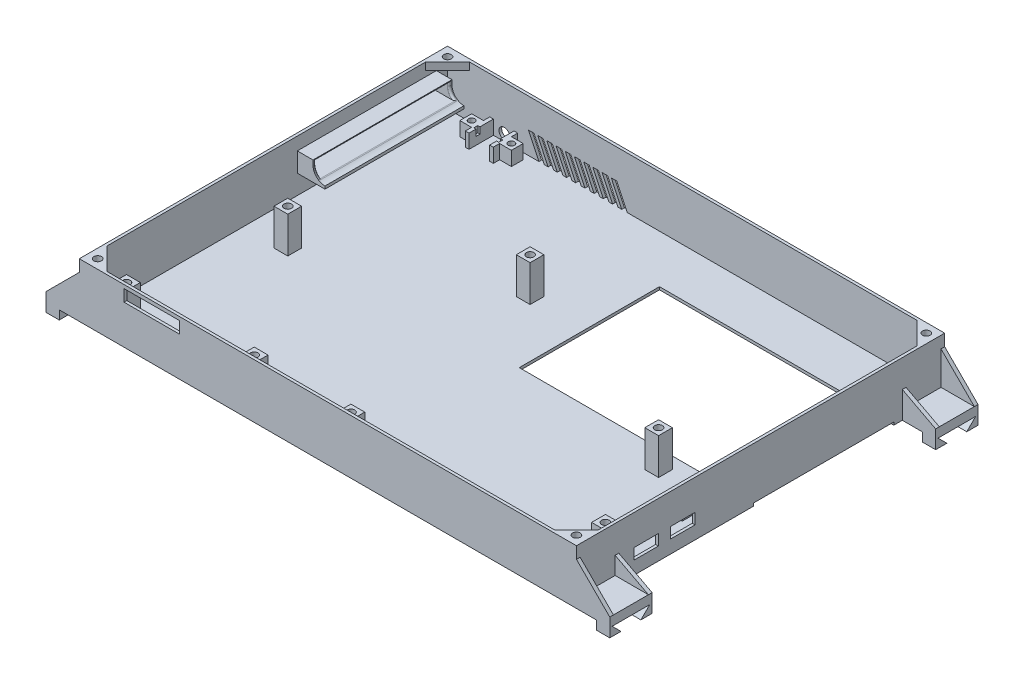
from build123d import *

# Parameters (mm, degrees)
SKETCH_1_W            = 270
SKETCH_1_H            = 200
EXTRUDE_1_DEPTH       = 1.5
EXTRUDE_2_DEPTH       = 28
SKETCH_3_W            = 30.2
SKETCH_3_H            = 1.5
EXTRUDE_3_DEPTH       = 19.7
SKETCH_4_W            = 1.5
SKETCH_4_H            = 1.9
EXTRUDE_4_DEPTH       = 30.2
SKETCH_5_W            = 13.3
SKETCH_5_H            = 5.9
CUT_EXTRUDE_1_DEPTH   = 1.5
SKETCH_10_W           = 7.5
SKETCH_10_H           = 7.5
EXTRUDE_6_DEPTH       = 6.9
SKETCH_11_W           = 7.5
SKETCH_11_H           = 7.5
EXTRUDE_7_DEPTH       = 19.7
SKETCH_12_W           = 127.3
SKETCH_12_H           = 76.15
CUT_EXTRUDE_2_DEPTH   = 171.320286519
SKETCH_14_R           = 2.05
CUT_EXTRUDE_4_DEPTH   = 5
SKETCH_15_R           = 2.05
CUT_EXTRUDE_5_DEPTH   = 5
EXTRUDE_START         = -7.58237
EXTRUDE_8_DEPTH       = 75.5
CUT_EXTRUDE_START     = -74
CUT_EXTRUDE_6_DEPTH   = 72.5
FILLET_1_R            = 1
SKETCH_19_W           = 15
SKETCH_19_H           = 1.5
EXTRUDE_9_DEPTH       = 75.5
CUT_EXTRUDE_7_DEPTH   = 1.5
SKETCH_21_R           = 2.9
CUT_EXTRUDE_8_DEPTH   = 1.5
SKETCH_22_W           = 2
SKETCH_22_H           = 13.25
EXTRUDE_10_DEPTH      = 7.65
SKETCH_23_W           = 1.2
SKETCH_23_H           = 2.2
CUT_EXTRUDE_9_DEPTH   = 3.45
SKETCH_24_W           = 6.4
SKETCH_24_H           = 6.4
EXTRUDE_11_DEPTH      = 7.65
SKETCH_25_R           = 1.7
CUT_EXTRUDE_10_DEPTH  = 3
EXTRUDE_12_DEPTH      = 4
SKETCH_27_R           = 2.05
CUT_EXTRUDE_11_DEPTH  = 4
SKETCH_29_W           = 23
SKETCH_29_H           = 5
EXTRUDE_13_DEPTH      = 18.1
EXTRUDE_14_DEPTH      = 7.2
EXTRUDE_15_DEPTH      = 2
EXTRUDE_16_DEPTH      = 2
MIRROR_7_COPY_1_DEPTH = 2
MIRROR_7_COPY_2_DEPTH = 2


with BuildPart() as part:
    # Эскиз1 → Бобышка-Вытянуть1 (new body)
    with BuildSketch(Plane(origin=(0, 0, 0), x_dir=(1, 0, 0), z_dir=(0, 1, 0))):
        Rectangle(SKETCH_1_W, SKETCH_1_H)
    extrude(amount=EXTRUDE_1_DEPTH)

    # Эскиз2 → Бобышка-Вытянуть2 (add)
    with BuildSketch(Plane(origin=(0, 1.5, 0), x_dir=(1, 0, 0), z_dir=(0, 1, 0))):
        Polygon((133.5, 98.5), (-133.5, 98.5), (-133.5, -98.5), (-110.7, -98.5), (-110.7, -100), (-135, -100), (-135, 100), (135, 100), (135, -100), (-80.5, -100), (-80.5, -98.5), (133.5, -98.5), align=None)
    extrude(amount=EXTRUDE_2_DEPTH)

    # Эскиз3 → Бобышка-Вытянуть3 (add)
    with BuildSketch(Plane(origin=(0, 1.5, 0), x_dir=(1, 0, 0), z_dir=(0, 1, 0))):
        with Locations((-95.6, -99.25)):
            Rectangle(SKETCH_3_W, SKETCH_3_H)
    extrude(amount=EXTRUDE_3_DEPTH)

    # Эскиз4 → Бобышка-Вытянуть4 (add)
    with BuildSketch(Plane(origin=(-110.7, 0, 0), x_dir=(0, 0, -1), z_dir=(1, 0, 0))):
        with Locations((-99.25, 28.55)):
            Rectangle(SKETCH_4_W, SKETCH_4_H)
    extrude(amount=EXTRUDE_4_DEPTH)

    # Эскиз5 → Вырез-Вытянуть1 (cut)
    with BuildSketch(Plane(origin=(135, 0, 0), x_dir=(0, 0, -1), z_dir=(1, 0, 0))):
        with Locations((-62.2, 10.05)):
            Rectangle(SKETCH_5_W, SKETCH_5_H)
        with Locations((-42.2, 10.05)):
            Rectangle(SKETCH_5_W, SKETCH_5_H)
    extrude(amount=-CUT_EXTRUDE_1_DEPTH, mode=Mode.SUBTRACT)

    # Эскиз10 → Бобышка-Вытянуть6 (add)
    with BuildSketch(Plane(origin=(0, 1.5, 0), x_dir=(1, 0, 0), z_dir=(0, 1, 0))):
        with Locations((120.425, -27.975)):
            Rectangle(SKETCH_10_W, SKETCH_10_H)
        with Locations((110.8, -60.05)):
            Rectangle(SKETCH_10_W, SKETCH_10_H)
        with Locations((111.425, -93.025)):
            Rectangle(SKETCH_10_W, SKETCH_10_H)
    extrude(amount=EXTRUDE_6_DEPTH)

    # Эскиз11 → Бобышка-Вытянуть7 (add)
    with BuildSketch(Plane(origin=(0, 1.5, 0), x_dir=(1, 0, 0), z_dir=(0, 1, 0))):
        with Locations((-50.49457, -89.5)):
            Rectangle(SKETCH_11_W, SKETCH_11_H)
        with Locations((-22.77243, 32.59906)):
            Rectangle(SKETCH_11_W, SKETCH_11_H)
        with Locations((-119.29457, -90.09238)):
            Rectangle(SKETCH_11_W, SKETCH_11_H)
        with Locations((-111.4, -10.38237)):
            Rectangle(SKETCH_11_W, SKETCH_11_H)
        with Locations((93.47787, -13.86955)):
            Rectangle(SKETCH_11_W, SKETCH_11_H)
        with Locations((90.30543, -95.26955)):
            Rectangle(SKETCH_11_W, SKETCH_11_H)
        with Locations((2.60543, -90.07853)):
            Rectangle(SKETCH_11_W, SKETCH_11_H)
    extrude(amount=EXTRUDE_7_DEPTH)

    # Эскиз12 → Вырез-Вытянуть2 (cut, through all)
    with BuildSketch(Plane(origin=(0, 1.5, 0), x_dir=(1, 0, 0), z_dir=(0, 1, 0))):
        with Locations((71.35, 34.325)):
            Rectangle(SKETCH_12_W, SKETCH_12_H)
    extrude(amount=-CUT_EXTRUDE_2_DEPTH, mode=Mode.SUBTRACT)

    # Эскиз14 → Вырез-Вытянуть4 (cut)
    with BuildSketch(Plane(origin=(0, 21.2, 0), x_dir=(1, 0, 0), z_dir=(0, 1, 0))):
        with Locations(Location((-22.77243, 32.59906, 0), (0, 0, 270))):
            Circle(SKETCH_14_R)
        with Locations(Location((-111.4, -10.38237, 0), (0, 0, 270))):
            Circle(SKETCH_14_R)
        with Locations(Location((-119.29457, -90.09238, 0), (0, 0, 270))):
            Circle(SKETCH_14_R)
        with Locations(Location((-50.49457, -89.5, 0), (0, 0, 270))):
            Circle(SKETCH_14_R)
        with Locations(Location((2.60543, -90.07853, 0), (0, 0, 270))):
            Circle(SKETCH_14_R)
        with Locations(Location((90.30543, -95.26955, 0), (0, 0, 270))):
            Circle(SKETCH_14_R)
        with Locations(Location((93.47787, -13.86955, 0), (0, 0, 270))):
            Circle(SKETCH_14_R)
    extrude(amount=-CUT_EXTRUDE_4_DEPTH, mode=Mode.SUBTRACT)

    # Эскиз15 → Вырез-Вытянуть5 (cut)
    with BuildSketch(Plane(origin=(0, 8.4, 0), x_dir=(1, 0, 0), z_dir=(0, 1, 0))):
        with Locations(Location((111.425, -93.025, 0), (0, 0, 270))):
            Circle(SKETCH_15_R)
        with Locations(Location((110.8, -60.05, 0), (0, 0, 270))):
            Circle(SKETCH_15_R)
        with Locations(Location((120.425, -27.975, 0), (0, 0, 270))):
            Circle(SKETCH_15_R)
    extrude(amount=-CUT_EXTRUDE_5_DEPTH, mode=Mode.SUBTRACT)

    # Эскиз16 → Бобышка-Вытянуть8 (add)
    with BuildSketch(Plane(origin=(0, 0, -100), x_dir=(-1, 0, 0), z_dir=(0, 0, -1)).offset(EXTRUDE_START)):
        with BuildLine():
            Line((133.5, 22.5), (125, 22.5))
            Line((125, 22.5), (125, 20))
            ThreePointArc((125, 20), (123.096194078, 15.403805922), (118.5, 13.5))
            Line((118.5, 13.5), (133.5, 13.5))
            Line((133.5, 13.5), (133.5, 22.5))
        make_face()
    extrude(amount=-EXTRUDE_8_DEPTH)

    # Эскиз18 → Вырез-Вытянуть6 (cut)
    with BuildSketch(Plane.XY.offset(-16.91763).offset(CUT_EXTRUDE_START)):
        with BuildLine():
            Line((-135, 21.5), (-125, 21.5))
            Line((-125, 21.5), (-125, 20))
            ThreePointArc((-125, 20), (-124.190635312, 16.858874445), (-121.964101615, 14.5))
            Line((-121.964101615, 14.5), (-135, 14.5))
            Line((-135, 14.5), (-135, 21.5))
        make_face()
    extrude(amount=CUT_EXTRUDE_6_DEPTH, mode=Mode.SUBTRACT)

    # Скругление1
    fillet_1_edges = [part.edges().sort_by_distance(p)[0] for p in [
        (-125, 21.5, -54.66763),
        (-121.964101615, 14.5, -54.66763),
        (-124.190635312, 16.858874445, -18.41763),
        (-125, 20.75, -18.41763),
        (-125, 20.75, -90.91763),
        (-124.190635312, 16.858874445, -90.91763),
    ]]
    fillet(fillet_1_edges, radius=FILLET_1_R - 0.0001)  # a hair under: the kernel refuses the full size

    # Эскиз19 → Бобышка-Вытянуть9 (add)
    with BuildSketch(Plane.XY.offset(-16.91763)):
        with Locations((-126, 12.75)):
            Rectangle(SKETCH_19_W, SKETCH_19_H)
    extrude(amount=-EXTRUDE_9_DEPTH)

    # Эскиз20 → Вырез-Вытянуть7 (cut)
    with BuildSketch(Plane(origin=(0, 0, -100), x_dir=(-1, 0, 0), z_dir=(0, 0, -1))):
        Polygon((89.570509561, 13.5), (86.570509561, 13.5), (80.9, 1.5), (83.9, 1.5), align=None)
        Polygon((35.9, 1.5), (41.570509561, 13.5), (44.570509561, 13.5), (38.9, 1.5), align=None)
        Polygon((40.9, 1.5), (46.570509561, 13.5), (49.570509561, 13.5), (43.9, 1.5), align=None)
        Polygon((45.9, 1.5), (51.570509561, 13.5), (54.570509561, 13.5), (48.9, 1.5), align=None)
        Polygon((50.9, 1.5), (56.570509561, 13.5), (59.570509561, 13.5), (53.9, 1.5), align=None)
        Polygon((55.9, 1.5), (61.570509561, 13.5), (64.570509561, 13.5), (58.9, 1.5), align=None)
        Polygon((60.9, 1.5), (66.570509561, 13.5), (69.570509561, 13.5), (63.9, 1.5), align=None)
        Polygon((65.9, 1.5), (71.570509561, 13.5), (74.570509561, 13.5), (68.9, 1.5), align=None)
        Polygon((70.9, 1.5), (76.570509561, 13.5), (79.570509561, 13.5), (73.9, 1.5), align=None)
        Polygon((75.9, 1.5), (81.570509561, 13.5), (84.570509561, 13.5), (78.9, 1.5), align=None)
    extrude(amount=-CUT_EXTRUDE_7_DEPTH, mode=Mode.SUBTRACT)

    # Эскиз21 → Вырез-Вытянуть8 (cut)
    with BuildSketch(Plane(origin=(0, 0, -100), x_dir=(-1, 0, 0), z_dir=(0, 0, -1))):
        with Locations((102.7, 5.325)):
            Circle(SKETCH_21_R)
    extrude(amount=-CUT_EXTRUDE_8_DEPTH, mode=Mode.SUBTRACT)

    # Эскиз22 → Бобышка-Вытянуть10 (add)
    with BuildSketch(Plane(origin=(0, 1.5, 0), x_dir=(1, 0, 0), z_dir=(0, 1, 0))):
        with Locations((-109.6, 91.875)):
            Rectangle(SKETCH_22_W, SKETCH_22_H)
        with Locations((-96.4, 91.875)):
            Rectangle(SKETCH_22_W, SKETCH_22_H)
    extrude(amount=EXTRUDE_10_DEPTH)

    # Эскиз23 → Вырез-Вытянуть9 (cut)
    with BuildSketch(Plane(origin=(0, 9.15, 0), x_dir=(1, 0, 0), z_dir=(0, 1, 0))):
        with Locations((-109.2, 90.1)):
            Rectangle(SKETCH_23_W, SKETCH_23_H)
        with Locations((-96.8, 90.1)):
            Rectangle(SKETCH_23_W, SKETCH_23_H)
    extrude(amount=-CUT_EXTRUDE_9_DEPTH, mode=Mode.SUBTRACT)

    # Эскиз24 → Бобышка-Вытянуть11 (add)
    with BuildSketch(Plane(origin=(0, 1.5, 0), x_dir=(1, 0, 0), z_dir=(0, 1, 0))):
        with Locations((-113.8, 91.875)):
            Rectangle(SKETCH_24_W, SKETCH_24_H)
        with Locations((-92.2, 91.875)):
            Rectangle(SKETCH_24_W, SKETCH_24_H)
    extrude(amount=EXTRUDE_11_DEPTH)

    # Эскиз25 → Вырез-Вытянуть10 (cut)
    with BuildSketch(Plane(origin=(0, 9.15, 0), x_dir=(1, 0, 0), z_dir=(0, 1, 0))):
        with Locations(Location((-113.8, 91.875, 0), (0, 0, 270))):
            Circle(SKETCH_25_R)
        with Locations(Location((-92.2, 91.875, 0), (0, 0, 270))):
            Circle(SKETCH_25_R)
    extrude(amount=-CUT_EXTRUDE_10_DEPTH, mode=Mode.SUBTRACT)

    # Эскиз26 → Бобышка-Вытянуть12 (add)
    with BuildSketch(Plane(origin=(0, 29.5, 0), x_dir=(1, 0, 0), z_dir=(0, 1, 0))):
        Polygon((121.5, 98.5), (133.5, 98.5), (133.5, 86.5), align=None)
        Polygon((133.5, -98.5), (133.5, -86.5), (121.5, -98.5), align=None)
        Polygon((-121.5, -98.5), (-133.5, -98.5), (-133.5, -86.5), align=None)
        Polygon((-133.5, 98.5), (-133.5, 86.5), (-121.5, 98.5), align=None)
    extrude(amount=-EXTRUDE_12_DEPTH)

    # Эскиз27 → Вырез-Вытянуть11 (cut)
    with BuildSketch(Plane(origin=(0, 29.5, 0), x_dir=(1, 0, 0), z_dir=(0, 1, 0))):
        with Locations(Location((130.010229073, 95.010229073, 0), (0, 0, 180))):
            Circle(SKETCH_27_R)
        with Locations((130.010229073, -95.010229073)):
            Circle(SKETCH_27_R)
        with Locations(Location((-130.010229073, -95.010229073, 0), (0, 0, 180))):
            Circle(SKETCH_27_R)
        with Locations((-130.010229073, 95.010229073)):
            Circle(SKETCH_27_R)
    extrude(amount=-CUT_EXTRUDE_11_DEPTH, mode=Mode.SUBTRACT)

    # Эскиз29 → Бобышка-Вытянуть13 (add)
    with BuildSketch(Plane(origin=(135, 0, 0), x_dir=(0, 0, -1), z_dir=(1, 0, 0))):
        with Locations((88.5, 2.5)):
            Rectangle(SKETCH_29_W, SKETCH_29_H)
        with Locations((-88.5, 2.5)):
            Rectangle(SKETCH_29_W, SKETCH_29_H)
    extrude_13 = extrude(amount=EXTRUDE_13_DEPTH)

    # Эскиз30 → Бобышка-Вытянуть14 (add)
    with BuildSketch(Plane(origin=(153.1, 0, 0), x_dir=(0, 0, -1), z_dir=(1, 0, 0))):
        Polygon((98.7, 0), (100, 0), (100, -4.8), (93.9, -4.8), align=None)
        Polygon((78.3, 0), (77, 0), (77, -4.8), (83.1, -4.8), align=None)
        Polygon((-77, -4.8), (-83.1, -4.8), (-78.3, 0), (-77, 0), align=None)
        Polygon((-100, -4.8), (-93.9, -4.8), (-98.7, 0), (-100, 0), align=None)
    extrude_14 = extrude(amount=-EXTRUDE_14_DEPTH)

    # Зеркальное отражение3: Бобышка-Вытянуть13 across plane
    add(extrude_13.mirror(Plane(origin=(0, 0, 0), x_dir=(0, 0, 1), z_dir=(1, 0, 0))))

    # Зеркальное отражение4: Бобышка-Вытянуть14 across plane
    add(extrude_14.mirror(Plane(origin=(0, 0, 0), x_dir=(0, 0, 1), z_dir=(1, 0, 0))))

    # Эскиз35 → Бобышка-Вытянуть15 (add)
    with BuildSketch(Plane(origin=(0, 0, -100), x_dir=(-1, 0, 0), z_dir=(0, 0, -1))):
        Polygon((153.1, 5), (135, 23.1), (135, 5), align=None)
    extrude_15 = extrude(amount=-EXTRUDE_15_DEPTH)

    # Эскиз36 → Бобышка-Вытянуть16 (add)
    with BuildSketch(Plane.XY.offset(-77)):
        Polygon((-153.1, 5), (-135, 14.5), (-135, 5), align=None)
    extrude_16 = extrude(amount=-EXTRUDE_16_DEPTH)

    # Зеркальное отражение6: Бобышка-Вытянуть15, Бобышка-Вытянуть16 across plane
    add(extrude_15.mirror(Plane.XY))
    add(extrude_16.mirror(Plane.XY))

    # Зеркальное отражение7: Бобышка-Вытянуть15, Бобышка-Вытянуть16 across plane
    add(extrude_15.mirror(Plane(origin=(0, 0, 0), x_dir=(0, 0, 1), z_dir=(1, 0, 0))))
    add(extrude_16.mirror(Plane(origin=(0, 0, 0), x_dir=(0, 0, 1), z_dir=(1, 0, 0))))

    # Зеркальное отражение7 copy 1 sketch → Зеркальное отражение7 copy 1 (add)
    with BuildSketch(Plane.XY.offset(100)):
        Polygon((153.1, 5), (135, 23.1), (135, 5), align=None)
    extrude(amount=-MIRROR_7_COPY_1_DEPTH)

    # Зеркальное отражение7 copy 2 sketch → Зеркальное отражение7 copy 2 (add)
    with BuildSketch(Plane(origin=(0, 0, 77), x_dir=(-1, 0, 0), z_dir=(0, 0, -1))):
        Polygon((-153.1, 5), (-135, 14.5), (-135, 5), align=None)
    extrude(amount=-MIRROR_7_COPY_2_DEPTH)


solid = part.part
